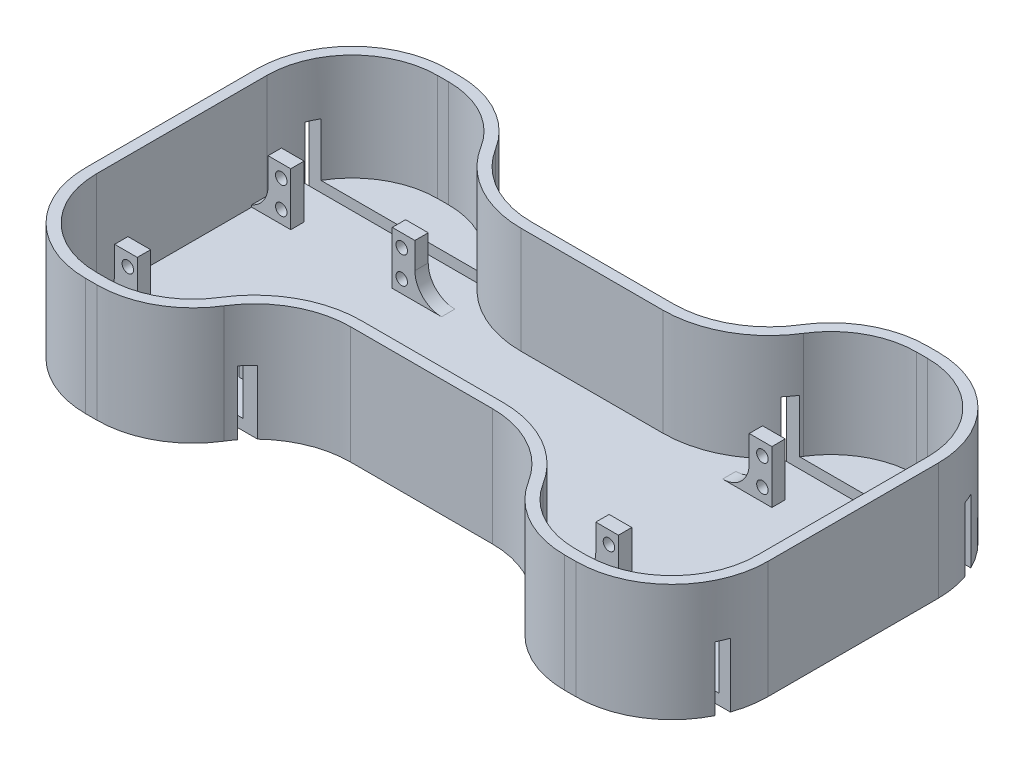
from build123d import *

# Parameters (mm, degrees)
BOSS_EXTRUDE1_DEPTH            = 4
FILLET2_R                      = 36
FILLET3_R                      = 36
EXTRUDE_THIN1_DEPTH            = 40
CUT_EXTRUDE1_REACH             = 152.36
SKETCH3_W                      = 90
SKETCH3_H                      = 4
CUT_EXTRUDE1_DIRECTION_2_DEPTH = 20
SKETCH4_W                      = 8.5
SKETCH4_H                      = 5
BOSS_EXTRUDE2_DEPTH            = 19.812
FILLET4_R                      = 10
CUT_EXTRUDE2_REACH             = 166.962
SKETCH5_R                      = 2.159
FILLET4_OF_MIRROR1_R           = 10
MIRROR2_START                  = 26.3
MIRROR2_OUTLINE_R              = 2.159
MIRROR2_DEPTH                  = 5
MIRROR2_2_DEPTH                = 24
MIRROR2_START_2                = 44
MIRROR2_3_OUTLINE_R            = 2.159
MIRROR2_3_DEPTH                = 4


# Read off the part's stored shape, not the designer's step: Mirror2
with BuildPart() as part:
    # Sketch1 → Boss-Extrude1 (new body)
    with BuildSketch(Plane(origin=(0, 0, 0), x_dir=(1, 0, 0), z_dir=(0, 1, 0))):
        Polygon((-128, 68), (-128, -68), (-51.8, -68), (-51.8, -34), (51.8, -34), (51.8, -68), (128, -68), (128, 68), (51.8, 68), (51.8, 34), (-51.8, 34), (-51.8, 68), align=None)
    extrude(amount=BOSS_EXTRUDE1_DEPTH)

    # Fillet2
    # the kernel refuses this fillet: 36 mm, written as the material it takes off along each edge
    with BuildSketch(Plane(origin=(-51.8, -89.861003778, -68), x_dir=(0, 0, 1), z_dir=(0, 1, 0)), Plane(origin=(51.8, -89.861003778, 68), x_dir=(0, 0, -1), z_dir=(0, 1, 0))) as fillet2_piece_1:
        with BuildLine():
            CenterArc((36, -35.944401511), FILLET2_R, 93.184738537, 86.815261463)
            Line((0, -35.944401511), (-0.72, -35.944401511))
            Line((-0.72, -35.944401511), (-0.72, 0))
            Line((-0.72, 0), (0, 0.72))
            ThreePointArc((0, 0.72), (17, 0.72), (33.96, 0.71888803))
            Line((33.96, 0.71888803), (34, 0))
        make_face()
    extrude(amount=183.722007556, mode=Mode.SUBTRACT)
    with BuildSketch(Plane(origin=(-128, -90, -68), x_dir=(0, 0, 1), z_dir=(0, 1, 0))) as fillet2_piece_2:
        with BuildLine():
            CenterArc((FILLET2_R, FILLET2_R), FILLET2_R, 180, 90)
            Line((0, FILLET2_R), (-FILLET2_R * 0.02, FILLET2_R))
            Line((-FILLET2_R * 0.02, FILLET2_R), (-FILLET2_R * 0.02, -FILLET2_R * 0.02))
            Line((-FILLET2_R * 0.02, -FILLET2_R * 0.02), (FILLET2_R, -FILLET2_R * 0.02))
            Line((FILLET2_R, -FILLET2_R * 0.02), (FILLET2_R, 0))
        make_face()
    extrude(amount=184, mode=Mode.SUBTRACT)
    with BuildSketch(Plane(origin=(-128, -90, 68), x_dir=(0, 0, -1), z_dir=(0, 1, 0)), Plane(origin=(128, -90, -68), x_dir=(0, 0, 1), z_dir=(0, 1, 0)), Plane(origin=(128, -90, 68), x_dir=(-1, 0, 0), z_dir=(0, 1, 0))) as fillet2_piece_3:
        with BuildLine():
            CenterArc((FILLET2_R, -FILLET2_R), FILLET2_R, 90, 90)
            Line((0, -FILLET2_R), (-FILLET2_R * 0.02, -FILLET2_R))
            Line((-FILLET2_R * 0.02, -FILLET2_R), (-FILLET2_R * 0.02, FILLET2_R * 0.02))
            Line((-FILLET2_R * 0.02, FILLET2_R * 0.02), (FILLET2_R, FILLET2_R * 0.02))
            Line((FILLET2_R, FILLET2_R * 0.02), (FILLET2_R, 0))
        make_face()
    extrude(amount=184, mode=Mode.SUBTRACT)
    with BuildSketch(Plane(origin=(-51.8, -89.861003778, 68), x_dir=(-1, 0, 0), z_dir=(0, 1, 0)), Plane(origin=(51.8, -89.861003778, -68), x_dir=(1, 0, 0), z_dir=(0, 1, 0))) as fillet2_piece_4:
        with BuildLine():
            CenterArc((35.944401511, -36), FILLET2_R, 90, 86.815261463)
            Line((0, -34), (-0.71888803, -33.96))
            ThreePointArc((-0.71888803, -33.96), (-0.72, -17), (-0.72, 0))
            Line((-0.72, 0), (0, 0.72))
            Line((0, 0.72), (35.944401511, 0.72))
            Line((35.944401511, 0.72), (35.944401511, 0))
        make_face()
    extrude(amount=183.722007556, mode=Mode.SUBTRACT)

    # Fillet3
    fillet3_edges = [part.edges().sort_by_distance(p)[0] for p in [
        (51.8, 2, 34),
        (-51.8, 2, 34),
        (-51.8, 2, -34),
        (51.8, 2, -34),
    ]]
    fillet(fillet3_edges, radius=FILLET3_R)

    # Sketch2 → Extrude-Thin1 (add)
    with BuildSketch(Plane(origin=(0, 4, 0), x_dir=(1, 0, 0), z_dir=(0, 1, 0))):
        with BuildLine():
            Line((-87.744401511, 68), (-92, 68))
            ThreePointArc((-92, 68), (-117.455844123, 57.455844123), (-128, 32))
            Line((-128, 32), (-128, -32))
            ThreePointArc((-128, -32), (-117.455844123, -57.455844123), (-92, -68))
            Line((-92, -68), (-87.744401511, -68))
            ThreePointArc((-87.744401511, -68), (-70.251545827, -63.464265445), (-57.166631808, -51))
            ThreePointArc((-57.166631808, -51), (-44.08171779, -38.535734555), (-26.588862106, -34))
            Line((-26.588862106, -34), (26.588862106, -34))
            ThreePointArc((26.588862106, -34), (44.08171779, -38.535734555), (57.166631808, -51))
            ThreePointArc((57.166631808, -51), (70.251545827, -63.464265445), (87.744401511, -68))
            Line((87.744401511, -68), (92, -68))
            ThreePointArc((92, -68), (117.455844123, -57.455844123), (128, -32))
            Line((128, -32), (128, 32))
            ThreePointArc((128, 32), (117.455844123, 57.455844123), (92, 68))
            Line((92, 68), (87.744401511, 68))
            ThreePointArc((87.744401511, 68), (70.251545827, 63.464265445), (57.166631808, 51))
            ThreePointArc((57.166631808, 51), (44.08171779, 38.535734555), (26.588862106, 34))
            Line((26.588862106, 34), (-26.588862106, 34))
            ThreePointArc((-26.588862106, 34), (-44.08171779, 38.535734555), (-57.166631808, 51))
            ThreePointArc((-57.166631808, 51), (-70.251545827, 63.464265445), (-87.744401511, 68))
        make_face()
        with BuildLine():
            Line((-87.744401511, 64), (-92, 64))
            ThreePointArc((-92, 64), (-114.627416998, 54.627416998), (-124, 32))
            Line((-124, 32), (-124, -32))
            ThreePointArc((-124, -32), (-114.627416998, -54.627416998), (-92, -64))
            Line((-92, -64), (-87.744401511, -64))
            ThreePointArc((-87.744401511, -64), (-72.195196458, -59.968235951), (-60.564161775, -48.888888889))
            ThreePointArc((-60.564161775, -48.888888889), (-46.025368422, -35.039705061), (-26.588862106, -30))
            Line((-26.588862106, -30), (26.588862106, -30))
            ThreePointArc((26.588862106, -30), (46.025368422, -35.039705061), (60.564161775, -48.888888889))
            ThreePointArc((60.564161775, -48.888888889), (72.195196458, -59.968235951), (87.744401511, -64))
            Line((87.744401511, -64), (92, -64))
            ThreePointArc((92, -64), (114.627416998, -54.627416998), (124, -32))
            Line((124, -32), (124, 32))
            ThreePointArc((124, 32), (114.627416998, 54.627416998), (92, 64))
            Line((92, 64), (87.744401511, 64))
            ThreePointArc((87.744401511, 64), (72.195196458, 59.968235951), (60.564161775, 48.888888889))
            ThreePointArc((60.564161775, 48.888888889), (46.025368422, 35.039705061), (26.588862106, 30))
            Line((26.588862106, 30), (-26.588862106, 30))
            ThreePointArc((-26.588862106, 30), (-46.025368422, 35.039705061), (-60.564161775, 48.888888889))
            ThreePointArc((-60.564161775, 48.888888889), (-72.195196458, 59.968235951), (-87.744401511, 64))
        make_face(mode=Mode.SUBTRACT)
    extrude(amount=EXTRUDE_THIN1_DEPTH)

    # Sketch3 → Cut-Extrude1 (cut, up to next)
    with BuildSketch(Plane(origin=(0, 4, 0), x_dir=(1, 0, 0), z_dir=(0, 1, 0)), mode=Mode.PRIVATE) as cut_extrude1_sk1:
        with Locations((-83, 46)):
            Rectangle(SKETCH3_W, SKETCH3_H)
    cut_extrude1_tool1 = extrude(cut_extrude1_sk1.sketch, amount=-CUT_EXTRUDE1_REACH, mode=Mode.PRIVATE) & part.part
    cut_extrude1 = cut_extrude1_tool1.solids().sort_by_distance((-83, 4, -46))[0]
    add(cut_extrude1, mode=Mode.SUBTRACT)

    # Sketch3 → Cut-Extrude1 direction 2 (cut)
    with BuildSketch(Plane(origin=(0, 4, 0), x_dir=(1, 0, 0), z_dir=(0, 1, 0))):
        with Locations((-83, 46)):
            Rectangle(SKETCH3_W, SKETCH3_H)
    cut_extrude1_direction_2 = extrude(amount=CUT_EXTRUDE1_DIRECTION_2_DEPTH, mode=Mode.SUBTRACT)

    # Sketch4 → Boss-Extrude2 (add)
    with BuildSketch(Plane(origin=(0, 4, 0), x_dir=(1, 0, 0), z_dir=(0, 1, 0))):
        with Locations((-66.999793948, 28.8)):
            Rectangle(SKETCH4_W, SKETCH4_H)
        with Locations((-113.599793948, 28.8)):
            Rectangle(SKETCH4_W, SKETCH4_H)
    boss_extrude2 = extrude(amount=BOSS_EXTRUDE2_DEPTH)

    # Fillet4
    # the kernel refuses this fillet: 10 mm, written as the material it adds along each edge
    with BuildSketch(Plane(origin=(-62.749793948, 4, -26.3), x_dir=(1, 0, 0), z_dir=(0, 0, -1))) as fillet4_piece_1:
        with BuildLine():
            CenterArc((FILLET4_R, -FILLET4_R), FILLET4_R, 90, 90)
            Line((0, -FILLET4_R), (0, 0))
            Line((0, 0), (FILLET4_R, 0))
        make_face()
    extrude(amount=5)
    with BuildSketch(Plane(origin=(-117.849793948, 4, -26.3), x_dir=(-1, 0, 0), z_dir=(0, 0, -1))) as fillet4_piece_2:
        with BuildLine():
            CenterArc((FILLET4_R, FILLET4_R), FILLET4_R, 180, 90)
            Line((0, FILLET4_R), (0, 0))
            Line((0, 0), (FILLET4_R, 0))
        make_face()
    extrude(amount=5)

    # Sketch5 → Cut-Extrude2 (cut, up to next)
    with BuildSketch(Plane.XY.offset(-26.3), mode=Mode.PRIVATE) as cut_extrude2_sk1:
        with Locations((-112.905793948, 18.986)):
            Circle(SKETCH5_R)
    cut_extrude2_tool1 = extrude(cut_extrude2_sk1.sketch, amount=-CUT_EXTRUDE2_REACH, mode=Mode.PRIVATE) & part.part
    # Sketch5 → Cut-Extrude2 (cut, up to next)
    with BuildSketch(Plane.XY.offset(-26.3), mode=Mode.PRIVATE) as cut_extrude2_sk2:
        with Locations((-112.905793948, 8.826)):
            Circle(SKETCH5_R)
    cut_extrude2_tool2 = extrude(cut_extrude2_sk2.sketch, amount=-CUT_EXTRUDE2_REACH, mode=Mode.PRIVATE) & part.part
    # Sketch5 → Cut-Extrude2 (cut, up to next)
    with BuildSketch(Plane.XY.offset(-26.3), mode=Mode.PRIVATE) as cut_extrude2_sk3:
        with Locations((-67.689793948, 18.986)):
            Circle(SKETCH5_R)
    cut_extrude2_tool3 = extrude(cut_extrude2_sk3.sketch, amount=-CUT_EXTRUDE2_REACH, mode=Mode.PRIVATE) & part.part
    # Sketch5 → Cut-Extrude2 (cut, up to next)
    with BuildSketch(Plane.XY.offset(-26.3), mode=Mode.PRIVATE) as cut_extrude2_sk4:
        with Locations((-67.689793948, 8.826)):
            Circle(SKETCH5_R)
    cut_extrude2_tool4 = extrude(cut_extrude2_sk4.sketch, amount=-CUT_EXTRUDE2_REACH, mode=Mode.PRIVATE) & part.part
    cut_extrude2_1 = cut_extrude2_tool1.solids().sort_by_distance((-112.905794, 18.986, -26.3))[0]
    add(cut_extrude2_1, mode=Mode.SUBTRACT)
    cut_extrude2_2 = cut_extrude2_tool2.solids().sort_by_distance((-112.905794, 8.826, -26.3))[0]
    add(cut_extrude2_2, mode=Mode.SUBTRACT)
    cut_extrude2_3 = cut_extrude2_tool3.solids().sort_by_distance((-67.689794, 18.986, -26.3))[0]
    add(cut_extrude2_3, mode=Mode.SUBTRACT)
    cut_extrude2_4 = cut_extrude2_tool4.solids().sort_by_distance((-67.689794, 8.826, -26.3))[0]
    add(cut_extrude2_4, mode=Mode.SUBTRACT)
    cut_extrude2 = cut_extrude2_1 + cut_extrude2_2 + cut_extrude2_3 + cut_extrude2_4  # Cut-Extrude2 as one shape, for the pattern or mirror that repeats it

    # Mirror1: Cut-Extrude1, Cut-Extrude1 direction 2, Boss-Extrude2, Cut-Extrude2 across plane
    add(cut_extrude1.mirror(Plane(origin=(0, 0, 0), x_dir=(0, 0, 1), z_dir=(1, 0, 0))), mode=Mode.SUBTRACT)
    add(cut_extrude1_direction_2.mirror(Plane(origin=(0, 0, 0), x_dir=(0, 0, 1), z_dir=(1, 0, 0))), mode=Mode.SUBTRACT)
    add(boss_extrude2.mirror(Plane(origin=(0, 0, 0), x_dir=(0, 0, 1), z_dir=(1, 0, 0))))
    add(cut_extrude2.mirror(Plane(origin=(0, 0, 0), x_dir=(0, 0, 1), z_dir=(1, 0, 0))), mode=Mode.SUBTRACT)

    # Fillet4 of Mirror1
    # the kernel refuses this fillet: 10 mm, written as the material it adds along each edge
    with BuildSketch(Plane(origin=(62.749793948, 4, -26.3), x_dir=(-1, 0, 0), z_dir=(0, 0, -1))) as fillet4_of_mirror1_piece_1:
        with BuildLine():
            CenterArc((FILLET4_OF_MIRROR1_R, FILLET4_OF_MIRROR1_R), FILLET4_OF_MIRROR1_R, 180, 90)
            Line((0, FILLET4_OF_MIRROR1_R), (0, 0))
            Line((0, 0), (FILLET4_OF_MIRROR1_R, 0))
        make_face()
    extrude(amount=5)
    with BuildSketch(Plane(origin=(117.849793948, 4, -26.3), x_dir=(1, 0, 0), z_dir=(0, 0, -1))) as fillet4_of_mirror1_piece_2:
        with BuildLine():
            CenterArc((FILLET4_OF_MIRROR1_R, -FILLET4_OF_MIRROR1_R), FILLET4_OF_MIRROR1_R, 90, 90)
            Line((0, -FILLET4_OF_MIRROR1_R), (0, 0))
            Line((0, 0), (FILLET4_OF_MIRROR1_R, 0))
        make_face()
    extrude(amount=5)

    # Mirror2 outline → Mirror2 (add)
    # profile 1 of 4: a face of its own
    with BuildSketch(Plane.XY.offset(MIRROR2_START)):
        with BuildLine():
            Line((-62.749793948, 23.812), (-71.249793948, 23.812))
            Line((-71.249793948, 23.812), (-71.249793948, 4))
            Line((-71.249793948, 4), (-52.749793948, 4))
            ThreePointArc((-52.749793948, 4), (-59.82086176, 6.928932188), (-62.749793948, 14))
            Line((-62.749793948, 14), (-62.749793948, 23.812))
        make_face()
        with Locations((-67.689793948, 8.826)):
            Circle(MIRROR2_OUTLINE_R, mode=Mode.SUBTRACT)
        with Locations((-67.689793948, 18.986)):
            Circle(MIRROR2_OUTLINE_R, mode=Mode.SUBTRACT)
    # profile 2 of 4: a face of its own
    with BuildSketch(Plane.XY.offset(MIRROR2_START)):
        with BuildLine():
            Line((109.349793948, 23.812), (109.349793948, 4))
            Line((109.349793948, 4), (124, 4))
            Line((124, 4), (124, 4.770748321))
            ThreePointArc((124, 4.770748321), (119.528197362, 8.454638852), (117.849793948, 14))
            Line((117.849793948, 14), (117.849793948, 23.812))
            Line((117.849793948, 23.812), (109.349793948, 23.812))
        make_face()
        with Locations((112.905793948, 8.826)):
            Circle(MIRROR2_OUTLINE_R, mode=Mode.SUBTRACT)
        with Locations((112.905793948, 18.986)):
            Circle(MIRROR2_OUTLINE_R, mode=Mode.SUBTRACT)
    # profile 3 of 4: a face of its own
    with BuildSketch(Plane.XY.offset(MIRROR2_START)):
        with BuildLine():
            ThreePointArc((62.749793948, 14), (59.82086176, 6.928932188), (52.749793948, 4))
            Line((52.749793948, 4), (71.249793948, 4))
            Line((71.249793948, 4), (71.249793948, 23.812))
            Line((71.249793948, 23.812), (62.749793948, 23.812))
            Line((62.749793948, 23.812), (62.749793948, 14))
        make_face()
        with Locations((67.689793948, 8.826)):
            Circle(MIRROR2_OUTLINE_R, mode=Mode.SUBTRACT)
        with Locations((67.689793948, 18.986)):
            Circle(MIRROR2_OUTLINE_R, mode=Mode.SUBTRACT)
    # profile 4 of 4: a face of its own
    with BuildSketch(Plane.XY.offset(MIRROR2_START)):
        with BuildLine():
            Line((-124, 4), (-109.349793948, 4))
            Line((-109.349793948, 4), (-109.349793948, 23.812))
            Line((-109.349793948, 23.812), (-117.849793948, 23.812))
            Line((-117.849793948, 23.812), (-117.849793948, 14))
            ThreePointArc((-117.849793948, 14), (-119.528197362, 8.454638852), (-124, 4.770748321))
            Line((-124, 4.770748321), (-124, 4))
        make_face()
        with Locations((-112.905793948, 8.826)):
            Circle(MIRROR2_OUTLINE_R, mode=Mode.SUBTRACT)
        with Locations((-112.905793948, 18.986)):
            Circle(MIRROR2_OUTLINE_R, mode=Mode.SUBTRACT)
    extrude(amount=MIRROR2_DEPTH)

    # Mirror2 2 outline → Mirror2 2 (cut)
    with BuildSketch(Plane(origin=(0, 0, 0), x_dir=(1, 0, 0), z_dir=(0, 1, 0))):
        with BuildLine():
            ThreePointArc((-125.941125497, -44), (-125.155455118, -46.025540844), (-124.249030993, -48))
            Line((-124.249030993, -48), (-55.084475803, -48))
            ThreePointArc((-55.084475803, -48), (-53.361376547, -45.932751082), (-51.488661302, -44))
            Line((-51.488661302, -44), (-125.941125497, -44))
        make_face()
        with BuildLine():
            ThreePointArc((124.249030993, -48), (125.155455118, -46.025540844), (125.941125497, -44))
            Line((125.941125497, -44), (51.488661302, -44))
            ThreePointArc((51.488661302, -44), (53.361376547, -45.932751082), (55.084475803, -48))
            Line((55.084475803, -48), (124.249030993, -48))
        make_face()
    extrude(amount=MIRROR2_2_DEPTH, mode=Mode.SUBTRACT)

    # Mirror2 3 outline → Mirror2 3 (cut)
    # profile 1 of 4: a face of its own
    with BuildSketch(Plane.XY.offset(MIRROR2_START_2)):
        with BuildLine():
            Line((-62.749793948, 23.812), (-71.249793948, 23.812))
            Line((-71.249793948, 23.812), (-71.249793948, 4))
            Line((-71.249793948, 4), (-52.749793948, 4))
            ThreePointArc((-52.749793948, 4), (-59.82086176, 6.928932188), (-62.749793948, 14))
            Line((-62.749793948, 14), (-62.749793948, 23.812))
        make_face()
        with Locations((-67.689793948, 8.826)):
            Circle(MIRROR2_3_OUTLINE_R, mode=Mode.SUBTRACT)
        with Locations((-67.689793948, 18.986)):
            Circle(MIRROR2_3_OUTLINE_R, mode=Mode.SUBTRACT)
    # profile 2 of 4: a face of its own
    with BuildSketch(Plane.XY.offset(MIRROR2_START_2)):
        with BuildLine():
            Line((109.349793948, 23.812), (109.349793948, 4))
            Line((109.349793948, 4), (124, 4))
            Line((124, 4), (124, 4.770748321))
            ThreePointArc((124, 4.770748321), (119.528197362, 8.454638852), (117.849793948, 14))
            Line((117.849793948, 14), (117.849793948, 23.812))
            Line((117.849793948, 23.812), (109.349793948, 23.812))
        make_face()
        with Locations((112.905793948, 8.826)):
            Circle(MIRROR2_3_OUTLINE_R, mode=Mode.SUBTRACT)
        with Locations((112.905793948, 18.986)):
            Circle(MIRROR2_3_OUTLINE_R, mode=Mode.SUBTRACT)
    # profile 3 of 4: a face of its own
    with BuildSketch(Plane.XY.offset(MIRROR2_START_2)):
        with BuildLine():
            ThreePointArc((62.749793948, 14), (59.82086176, 6.928932188), (52.749793948, 4))
            Line((52.749793948, 4), (71.249793948, 4))
            Line((71.249793948, 4), (71.249793948, 23.812))
            Line((71.249793948, 23.812), (62.749793948, 23.812))
            Line((62.749793948, 23.812), (62.749793948, 14))
        make_face()
        with Locations((67.689793948, 8.826)):
            Circle(MIRROR2_3_OUTLINE_R, mode=Mode.SUBTRACT)
        with Locations((67.689793948, 18.986)):
            Circle(MIRROR2_3_OUTLINE_R, mode=Mode.SUBTRACT)
    # profile 4 of 4: a face of its own
    with BuildSketch(Plane.XY.offset(MIRROR2_START_2)):
        with BuildLine():
            Line((-124, 4), (-109.349793948, 4))
            Line((-109.349793948, 4), (-109.349793948, 23.812))
            Line((-109.349793948, 23.812), (-117.849793948, 23.812))
            Line((-117.849793948, 23.812), (-117.849793948, 14))
            ThreePointArc((-117.849793948, 14), (-119.528197362, 8.454638852), (-124, 4.770748321))
            Line((-124, 4.770748321), (-124, 4))
        make_face()
        with Locations((-112.905793948, 8.826)):
            Circle(MIRROR2_3_OUTLINE_R, mode=Mode.SUBTRACT)
        with Locations((-112.905793948, 18.986)):
            Circle(MIRROR2_3_OUTLINE_R, mode=Mode.SUBTRACT)
    extrude(amount=MIRROR2_3_DEPTH, mode=Mode.SUBTRACT)


solid = part.part
